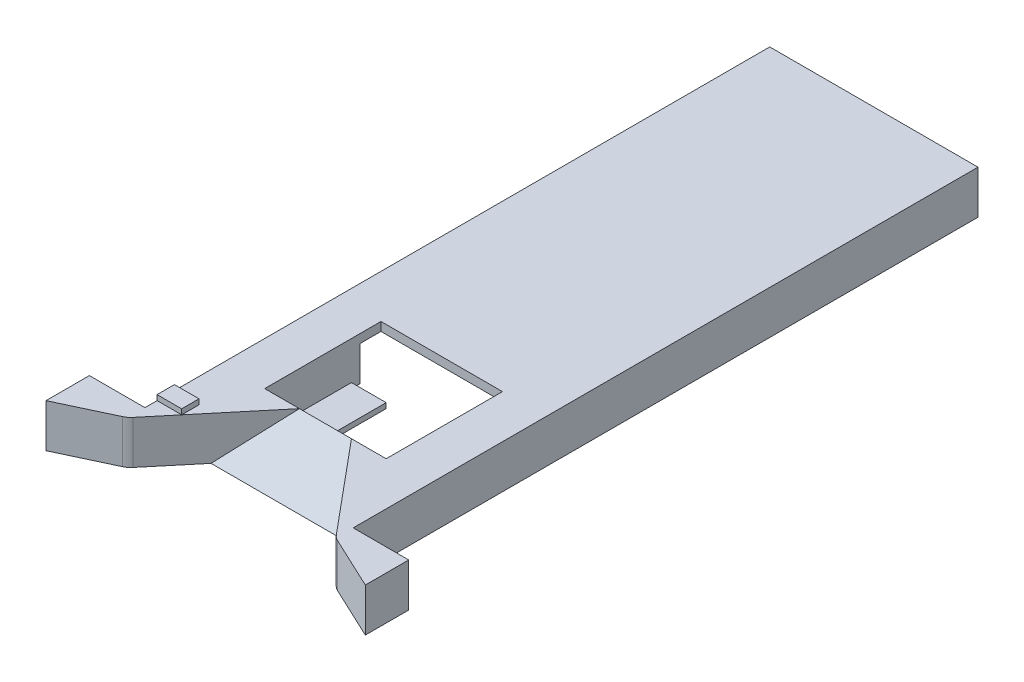
from build123d import *

# Parameters (mm, degrees)
BOSS_EXTRUDE1_DEPTH      = 27
CUT_EXTRUDE1_DEPTH       = 29
CUT_EXTRUDE1_DEPTH_BACK  = 70
BOSS_EXTRUDE2_DEPTH      = 27
SKETCH9_W                = 14.166666667
SKETCH9_H                = 10
BOSS_EXTRUDE3_DEPTH      = 3
SKETCH10_W               = 30
SKETCH10_H               = 50
CUT_EXTRUDE7_DEPTH       = 326.898757285
SKETCH11_W               = 20
SKETCH11_H               = 50
CUT_EXTRUDE9_DEPTH       = 22
BOSS_EXTRUDE4_DEPTH      = 27
FILLET1_R                = 10
FILLET2_R                = 10
CUT_EXTRUDE10_DEPTH      = 367.89508037
CUT_EXTRUDE10_DEPTH_BACK = 367.89508037
SKETCH17_W               = 385
SKETCH17_H               = 2
SKETCH18_W               = 20
SKETCH18_H               = 50
CUT_EXTRUDE11_DEPTH      = 22
SHELL1_START             = 2
SHELL1_DEPTH             = 20
SHELL1_START_2           = -55
SHELL1_2_DEPTH           = 80
CUT_EXTRUDE12_DEPTH      = 335.559411764
CUT_EXTRUDE12_DEPTH_BACK = 335.559411764
SKETCH20_W               = 70
SKETCH20_H               = 17


with BuildPart() as part:
    # Sketch1 → Boss-Extrude1 (new body)
    with BuildSketch(Plane(origin=(0, 0, 0), x_dir=(1, 0, 0), z_dir=(0, 1, 0))):
        Polygon((-30, 0), (-55, -30), (-15, -30), (-15, 0), align=None)
        Polygon((-15, 0), (-15, -30), (25, -30), (0, 0), align=None)
    extrude(amount=BOSS_EXTRUDE1_DEPTH)

    # Sketch3 → Cut-Extrude1 (cut, two sides: drawn at the far end of the back side and taken through both)
    with BuildSketch(Plane(origin=(0, 0, 0), x_dir=(0, 0, -1), z_dir=(1, 0, 0)).offset(-CUT_EXTRUDE1_DEPTH_BACK)):
        Polygon((-30, 0), (0, 27), (-30, 27), align=None)
    extrude(amount=CUT_EXTRUDE1_DEPTH + CUT_EXTRUDE1_DEPTH_BACK, mode=Mode.SUBTRACT)

    # Sketch5 → Boss-Extrude2 (add)
    with BuildSketch(Plane(origin=(0, 0, 0), x_dir=(1, 0, 0), z_dir=(0, 1, 0))):
        Polygon((-55, -30), (-75, -54), (-75, 316), (45, 316), (45, -54), (25, -30), (0, 0), (-30, 0), align=None)
    extrude(amount=BOSS_EXTRUDE2_DEPTH)

    # Sketch9 → Boss-Extrude3 (add)
    with BuildSketch(Plane(origin=(0, 27, 0), x_dir=(1, 0, 0), z_dir=(0, 1, 0))):
        with Locations((-67.916666667, -32)):
            Rectangle(SKETCH9_W, SKETCH9_H)
    extrude(amount=BOSS_EXTRUDE3_DEPTH)

    # Sketch10 → Cut-Extrude7 (cut, through all)
    with BuildSketch(Plane(origin=(0, 27, 0), x_dir=(1, 0, 0), z_dir=(0, 1, 0))):
        with Locations((-15, 25)):
            Rectangle(SKETCH10_W, SKETCH10_H)
    extrude(amount=-CUT_EXTRUDE7_DEPTH, mode=Mode.SUBTRACT)

    # Sketch11 → Cut-Extrude9 (cut)
    with BuildSketch(Plane(origin=(0, 27, 0), x_dir=(1, 0, 0), z_dir=(0, 1, 0))):
        with Locations((-40, 25)):
            Rectangle(SKETCH11_W, SKETCH11_H)
    extrude(amount=-CUT_EXTRUDE9_DEPTH, mode=Mode.SUBTRACT)

    # Sketch16 → Boss-Extrude4 (add)
    with BuildSketch(Plane(origin=(0, 27, 0), x_dir=(1, 0, 0), z_dir=(0, 1, 0))):
        Polygon((-75, -54), (-107, -69), (-107, -54), (-107, -44), (-75, -44), align=None)
    boss_extrude4 = extrude(amount=-BOSS_EXTRUDE4_DEPTH)

    # Mirror1: Boss-Extrude4 across plane
    add(boss_extrude4.mirror(Plane.ZY.offset(15)))

    # Fillet1
    fillet1_edges = [part.edges().sort_by_distance(p)[0] for p in [
        (-75, 13.5, 54),
    ]]
    fillet(fillet1_edges, radius=FILLET1_R)

    # Fillet2
    fillet2_edges = [part.edges().sort_by_distance(p)[0] for p in [
        (45, 13.5, 54),
    ]]
    fillet(fillet2_edges, radius=FILLET2_R)

    # Sketch17 → Cut-Extrude10 (cut, two sides: drawn at the far end of the back side and taken through both)
    with BuildSketch(Plane(origin=(77, 0, 0), x_dir=(0, 0, -1), z_dir=(1, 0, 0)).offset(-CUT_EXTRUDE10_DEPTH_BACK)):
        with Locations((123.5, 1)):
            Rectangle(SKETCH17_W, SKETCH17_H)
    extrude(amount=CUT_EXTRUDE10_DEPTH + CUT_EXTRUDE10_DEPTH_BACK, mode=Mode.SUBTRACT)

    # Sketch18 → Cut-Extrude11 (cut)
    with BuildSketch(Plane(origin=(0, 27, 0), x_dir=(1, 0, 0), z_dir=(0, 1, 0))):
        with Locations((10, 25)):
            Rectangle(SKETCH18_W, SKETCH18_H)
    extrude(amount=-CUT_EXTRUDE11_DEPTH, mode=Mode.SUBTRACT)

    # Shell1: read off the stored shape, not the designer's step
    # Shell1 outline → Shell1 (cut)
    with BuildSketch(Plane(origin=(0, 0, 0), x_dir=(1, 0, 0), z_dir=(0, 1, 0)).offset(SHELL1_START)):
        Polygon((25, 55), (25, -5), (10.675208063, -5), (40, -40.189750324), (40, 311), (-70, 311), (-70, -40.189750324), (-40.675208063, -5), (-55, -5), (-55, 55), align=None)
        with BuildLine():
            Line((47.34187473, -49), (47.417185838, -49.090373329))
            ThreePointArc((47.417185838, -49.090373329), (48.203790537, -49.847988861), (49.136122855, -50.416746011))
            Line((49.136122855, -50.416746011), (72, -61.134188423))
            Line((72, -61.134188423), (72, -49))
            Line((72, -49), (47.34187473, -49))
        make_face()
        with BuildLine():
            Line((-77.417185838, -49.090373329), (-77.34187473, -49))
            Line((-77.34187473, -49), (-102, -49))
            Line((-102, -49), (-102, -61.134188423))
            Line((-102, -61.134188423), (-79.136122855, -50.416746011))
            ThreePointArc((-79.136122855, -50.416746011), (-78.203790537, -49.847988861), (-77.417185838, -49.090373329))
        make_face()
    extrude(amount=SHELL1_DEPTH, mode=Mode.SUBTRACT)

    # Shell1 2 outline → Shell1 2 (cut)
    with BuildSketch(Plane.YZ.offset(SHELL1_START_2)):
        Polygon((2, 5), (15.773187976, 5), (2, 20.303542196), align=None)
    extrude(amount=SHELL1_2_DEPTH, mode=Mode.SUBTRACT)

    # Sketch20 → Cut-Extrude12 (cut, two sides: drawn at the far end of the back side and taken through both)
    with BuildSketch(Plane(origin=(0, 27, 0), x_dir=(1, 0, 0), z_dir=(0, 1, 0)).offset(-CUT_EXTRUDE12_DEPTH_BACK)):
        with Locations((-15, 58.5)):
            Rectangle(SKETCH20_W, SKETCH20_H)
    extrude(amount=CUT_EXTRUDE12_DEPTH + CUT_EXTRUDE12_DEPTH_BACK, mode=Mode.SUBTRACT)


solid = part.part
